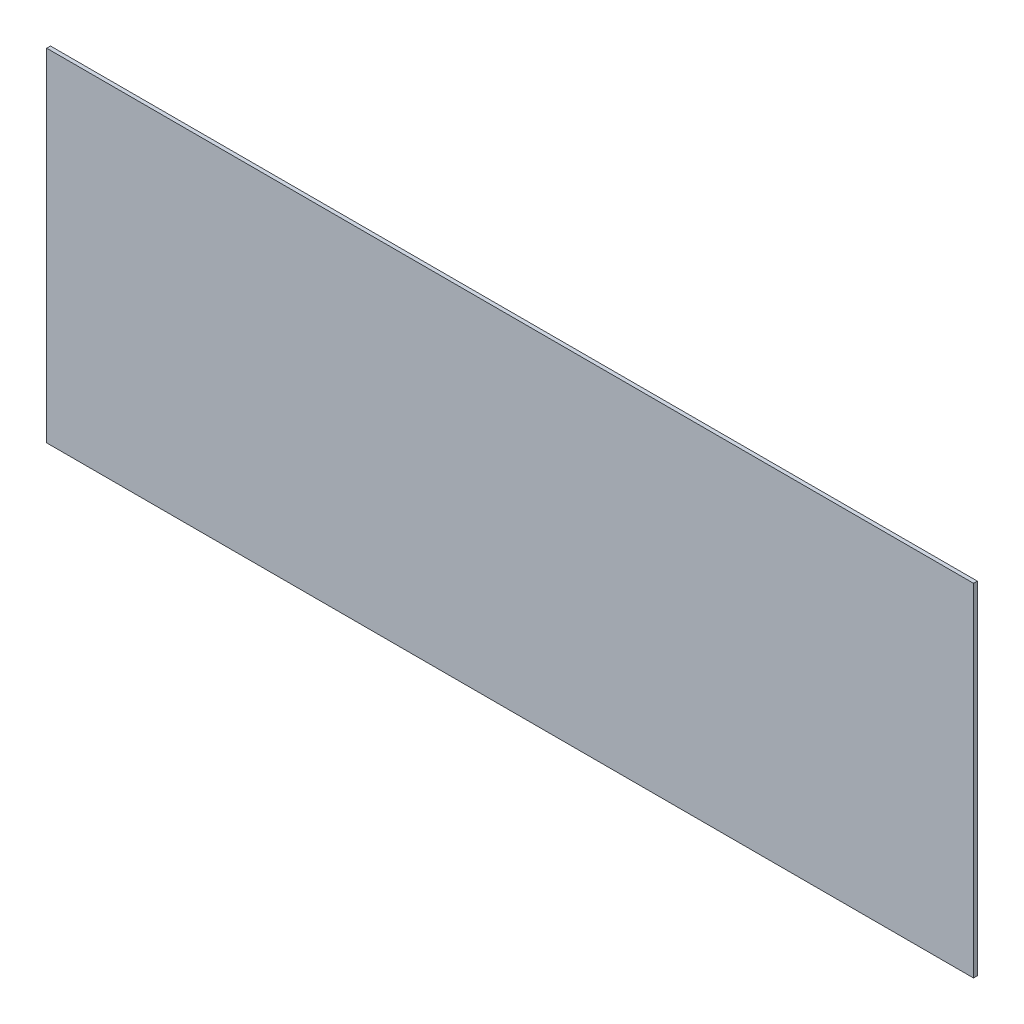
from build123d import *

# Parameters (mm, degrees)
SKETCH_1_W      = 2440
SKETCH_1_H      = 900
EXTRUDE_1_DEPTH = 10


with BuildPart() as part:
    # Эскиз1 → Бобышка-Вытянуть1 (new body)
    with BuildSketch(Plane.XY):
        with Locations((1220, 450)):
            Rectangle(SKETCH_1_W, SKETCH_1_H)
    extrude(amount=EXTRUDE_1_DEPTH)


solid = part.part
